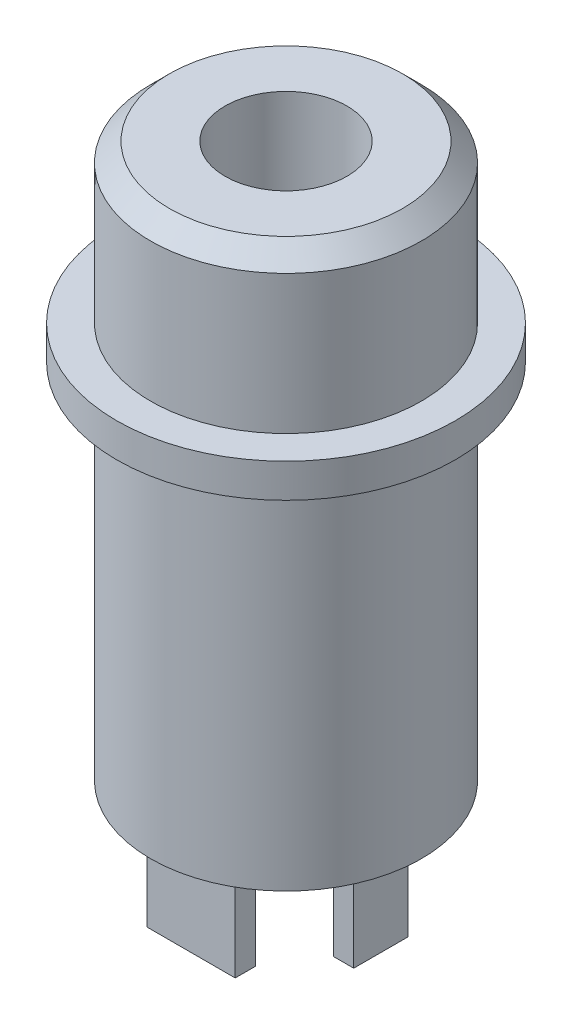
from build123d import *

# Parameters (mm, degrees)
SKETCH1_R           = 4
SKETCH1_R_2         = 1.8
SKETCH1_W           = 1.6
SKETCH1_H           = 0.6
SKETCH1_W_2         = 0.6
SKETCH1_H_2         = 1.6
SKETCH1_W_3         = 2.6
BOSS_EXTRUDE1_DEPTH = 11.7
SKETCH1_3_R         = 5
SKETCH1_3_R_2       = 4
BOSS_EXTRUDE2_DEPTH = 1
CUT_EXTRUDE1_START  = 4.65
SKETCH1_7_R         = 1.8
CUT_EXTRUDE1_DEPTH  = 15.2
BOSS_EXTRUDE5_START = -11.7
SKETCH1_8_W         = 0.6
SKETCH1_8_H         = 1.6
SKETCH1_8_W_2       = 1.6
SKETCH1_8_H_2       = 0.6
SKETCH1_8_W_3       = 2.6
BOSS_EXTRUDE5_DEPTH = 3


# Read off the part's stored shape, not the designer's step: M8x1.0 Machine Threads Stud3
with BuildPart() as part:
    # Sketch1 → Boss-Extrude1 (new body)
    with BuildSketch(Plane(origin=(0, 0, 0), x_dir=(1, 0, 0), z_dir=(0, 1, 0))):
        with Locations(Location((0, 0, 0), (0, 0, 270))):
            Circle(SKETCH1_R)
        Circle(SKETCH1_R_2)
        with Locations((0, 2.5)):
            Rectangle(SKETCH1_W, SKETCH1_H)
        with Locations((2.5, 0)):
            Rectangle(SKETCH1_W_2, SKETCH1_H_2)
        with Locations((0, -2.5)):
            Rectangle(SKETCH1_W_3, SKETCH1_H)
        with Locations((-2.5, 0)):
            Rectangle(SKETCH1_W_2, SKETCH1_H_2)
    extrude(amount=-BOSS_EXTRUDE1_DEPTH)

    # Sketch1<3> → Boss-Extrude2 (add)
    with BuildSketch(Plane(origin=(0, 0, 0), x_dir=(1, 0, 0), z_dir=(0, 1, 0))):
        with Locations(Location((0, 0, 0), (0, 0, 270))):
            Circle(SKETCH1_3_R)
        with Locations(Location((0, 0, 0), (0, 0, 270))):
            Circle(SKETCH1_3_R_2, mode=Mode.SUBTRACT)
    extrude(amount=-BOSS_EXTRUDE2_DEPTH)

    # M8x1.0 Machine Threads Stud3 outline → M8x1.0 Machine Threads Stud3 (revolve)
    with BuildSketch(Plane.XY):
        Polygon((4, 0), (4, 4.0955), (3.4455, 4.65), (0, 4.65), (0, 0), align=None)
    revolve(axis=Axis((0, 0, 0), (0, 1, 0)))

    # Sketch1<7> → Cut-Extrude1 (cut)
    with BuildSketch(Plane(origin=(0, 0, 0), x_dir=(1, 0, 0), z_dir=(0, 1, 0)).offset(CUT_EXTRUDE1_START)):
        with Locations(Location((0, 0, 0), (0, 0, 270))):
            Circle(SKETCH1_7_R)
    extrude(amount=-CUT_EXTRUDE1_DEPTH, mode=Mode.SUBTRACT)

    # Sketch1<8> → Boss-Extrude5 (add)
    with BuildSketch(Plane(origin=(0, 0, 0), x_dir=(1, 0, 0), z_dir=(0, 1, 0)).offset(BOSS_EXTRUDE5_START)):
        with Locations((2.5, 0)):
            Rectangle(SKETCH1_8_W, SKETCH1_8_H)
        with Locations((0, 2.5)):
            Rectangle(SKETCH1_8_W_2, SKETCH1_8_H_2)
        with Locations((-2.5, 0)):
            Rectangle(SKETCH1_8_W, SKETCH1_8_H)
        with Locations((0, -2.5)):
            Rectangle(SKETCH1_8_W_3, SKETCH1_8_H_2)
    extrude(amount=-BOSS_EXTRUDE5_DEPTH)


solid = part.part
